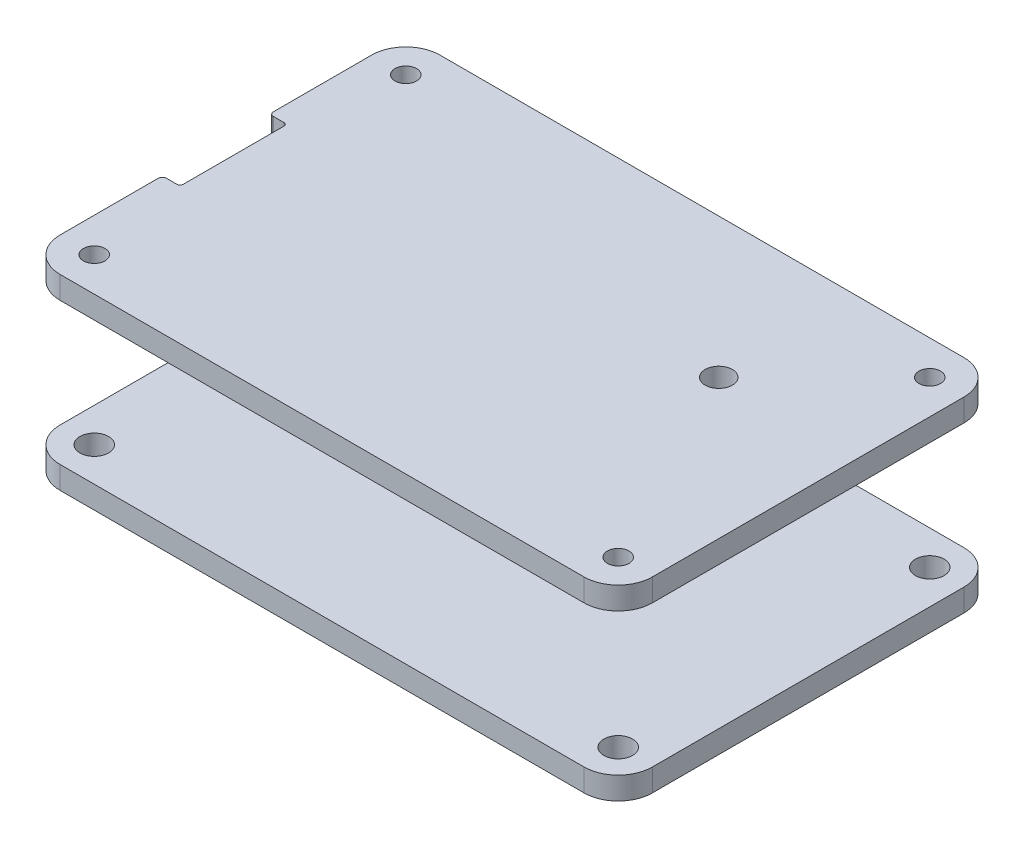
from build123d import *

# Parameters (mm, degrees)
BOSS_EXTRUDE1_DEPTH             = 20.07
SKETCH3_R                       = 1.6
BOSS_EXTRUDE2_DEPTH             = 5.5
FILLET1_R                       = 2.5
CUT_EXTRUDE1_REACH              = 102.265
SKETCH4_R                       = 3.25
CUT_EXTRUDE2_REACH              = 102.265
SKETCH5_R                       = 2.15
CUT_EXTRUDE5_REACH              = 101.74
MOVE_START                      = 79.994994432
MOVE_FACE1_OUTLINE_R            = 3.75
MOVE_FACE1_OUTLINE_R_2          = 3.25
MOVE_FACE1_DEPTH                = 3.005005568
MOVE_START_2                    = -3
MOVE_FACE1_2_OUTLINE_R          = 2.65
MOVE_FACE1_2_OUTLINE_R_2        = 2.15
MOVE_FACE1_2_DEPTH              = 82.994994432
MOVE_FACE2_BY                   = 0.1
MOVE_FACE2_2_BY                 = 0.1
MOVE_FACE2_3_BY                 = 0.1
MOVE_FACE2_4_BY                 = 0.1
MOVE_FACE2_5_BY                 = 0.1
MOVE_FACE2_6_BY                 = 0.1
MOVE_FACE2_7_BY                 = 0.1
MOVE_FACE2_8_BY                 = 0.1
MOVE_FACE2_9_BY                 = 0.1
MOVE_FACE2_10_BY                = 0.1
MOVE_FACE2_11_BY                = 0.1
MOVE_FACE3_BY                   = 0.1
MOVE_FACE3_2_BY                 = 0.1
MOVE_FACE3_3_BY                 = 0.1
MOVE_FACE3_4_BY                 = 0.1
SKETCH6_R                       = 1.6
BOSS_EXTRUDE3_DEPTH             = 3.175
SKETCH7_R                       = 2
CUT_EXTRUDE3_DEPTH              = 3.175
SKETCH8_W                       = 2.5
SKETCH8_H                       = 15.2622
CUT_EXTRUDE4_DEPTH              = 3.175
SKETCH10_R                      = 2.1
M3_HEAT_SET_INSERT_HOLES_DEPTH  = 3.175
FILLET2_R                       = 0.5
KERF_START                      = -3.175
KERF_COMPENSATION_OUTLINE_R     = 2.1
KERF_COMPENSATION_OUTLINE_R_2   = 2.0238
KERF_COMPENSATION_DEPTH         = 3.175
KERF_START_2                    = 20.07
KERF_COMPENSATION_2_OUTLINE_R   = 1.6
KERF_COMPENSATION_2_OUTLINE_R_2 = 1.5238
KERF_COMPENSATION_2_OUTLINE_R_3 = 2
KERF_COMPENSATION_2_OUTLINE_R_4 = 1.9238
KERF_COMPENSATION_2_DEPTH       = 3.175


with BuildPart() as part:
    # Sketch2 → Boss-Extrude1 (new body)
    with BuildSketch(Plane(origin=(0, 0, 0), x_dir=(1, 0, 0), z_dir=(0, 1, 0))):
        with BuildLine():
            Line((77, 51.75), (3, 51.75))
            ThreePointArc((3, 51.75), (-0.358757211, 50.358757211), (-1.75, 47))
            Line((-1.75, 47), (-1.75, 3))
            ThreePointArc((-1.75, 3), (-0.358757211, -0.358757211), (3, -1.75))
            Line((3, -1.75), (77, -1.75))
            ThreePointArc((77, -1.75), (80.358757211, -0.358757211), (81.75, 3))
            Line((81.75, 3), (81.75, 47))
            ThreePointArc((81.75, 47), (80.358757211, 50.358757211), (77, 51.75))
        make_face()
        with BuildLine():
            Line((-0.25, 47), (-0.25, 3))
            ThreePointArc((-0.25, 3), (0.701902961, 0.701902961), (3, -0.25))
            Line((3, -0.25), (77, -0.25))
            ThreePointArc((77, -0.25), (79.298097039, 0.701902961), (80.25, 3))
            Line((80.25, 3), (80.25, 47))
            ThreePointArc((80.25, 47), (79.298097039, 49.298097039), (77, 50.25))
            Line((77, 50.25), (3, 50.25))
            ThreePointArc((3, 50.25), (0.701902961, 49.298097039), (-0.25, 47))
        make_face(mode=Mode.SUBTRACT)
    extrude(amount=BOSS_EXTRUDE1_DEPTH)

    # Sketch3 → Boss-Extrude2 (add)
    # profile 1 of 4: a face of its own
    with BuildSketch(Plane.XZ):
        with BuildLine():
            ThreePointArc((-0.25, -47), (0.701902961, -49.298097039), (3, -50.25))
            Line((3, -50.25), (5.5, -50.25))
            Line((5.5, -50.25), (5.5, -44.5))
            Line((5.5, -44.5), (-0.25, -44.5))
            Line((-0.25, -44.5), (-0.25, -47))
        make_face()
        with Locations(Location((3, -47, 0), (0, 0, 270))):
            Circle(SKETCH3_R, mode=Mode.SUBTRACT)
    # profile 2 of 4: a face of its own
    with BuildSketch(Plane.XZ):
        with BuildLine():
            Line((74.5, -44.5), (74.5, -50.25))
            Line((74.5, -50.25), (77, -50.25))
            ThreePointArc((77, -50.25), (79.298097039, -49.298097039), (80.25, -47))
            Line((80.25, -47), (80.25, -44.5))
            Line((80.25, -44.5), (74.5, -44.5))
        make_face()
        with Locations(Location((77, -47, 0), (0, 0, 270))):
            Circle(SKETCH3_R, mode=Mode.SUBTRACT)
    # profile 3 of 4: a face of its own
    with BuildSketch(Plane.XZ):
        with BuildLine():
            Line((74.5, -5.5), (80.25, -5.5))
            Line((80.25, -5.5), (80.25, -3))
            ThreePointArc((80.25, -3), (79.298097039, -0.701902961), (77, 0.25))
            Line((77, 0.25), (74.5, 0.25))
            Line((74.5, 0.25), (74.5, -5.5))
        make_face()
        with Locations(Location((77, -3, 0), (0, 0, 270))):
            Circle(SKETCH3_R, mode=Mode.SUBTRACT)
    # profile 4 of 4: a face of its own
    with BuildSketch(Plane.XZ):
        with BuildLine():
            Line((-0.25, -3), (-0.25, -5.5))
            Line((-0.25, -5.5), (5.5, -5.5))
            Line((5.5, -5.5), (5.5, 0.25))
            Line((5.5, 0.25), (3, 0.25))
            ThreePointArc((3, 0.25), (0.701902961, -0.701902961), (-0.25, -3))
        make_face()
        with Locations(Location((3, -3, 0), (0, 0, 270))):
            Circle(SKETCH3_R, mode=Mode.SUBTRACT)
    extrude(amount=-BOSS_EXTRUDE2_DEPTH)

    # Fillet1
    fillet1_edges = [part.edges().sort_by_distance(p)[0] for p in [
        (5.5, 2.75, 0.25),
        (5.5, 2.75, -5.5),
        (-0.25, 2.75, -5.5),
        (5.5, 2.75, -44.5),
        (5.5, 2.75, -50.25),
        (-0.25, 2.75, -44.5),
        (74.5, 2.75, -50.25),
        (74.5, 2.75, -44.5),
        (80.25, 2.75, -44.5),
        (74.5, 2.75, -5.5),
        (74.5, 2.75, 0.25),
        (80.25, 2.75, -5.5),
    ]]
    fillet(fillet1_edges, radius=FILLET1_R)

    # Sketch4 → Cut-Extrude1 (cut, up to next)
    with BuildSketch(Plane(origin=(81.75, 0, 0), x_dir=(0, 0, -1), z_dir=(1, 0, 0)), mode=Mode.PRIVATE) as cut_extrude1_sk1:
        with Locations((11.25, 13.5662)):
            Circle(SKETCH4_R)
    cut_extrude1_tool1 = extrude(cut_extrude1_sk1.sketch, amount=-CUT_EXTRUDE1_REACH, mode=Mode.PRIVATE) & part.part
    # Sketch4 → Cut-Extrude1 (cut, up to next)
    with BuildSketch(Plane(origin=(81.75, 0, 0), x_dir=(0, 0, -1), z_dir=(1, 0, 0)), mode=Mode.PRIVATE) as cut_extrude1_sk2:
        with BuildLine():
            Line((21.83, 7.07), (28.17, 7.07))
            ThreePointArc((28.17, 7.07), (29.089238816, 7.450761184), (29.47, 8.37))
            Line((29.47, 8.37), (29.47, 9.13))
            ThreePointArc((29.47, 9.13), (29.089238816, 10.049238816), (28.17, 10.43))
            Line((28.17, 10.43), (21.83, 10.43))
            ThreePointArc((21.83, 10.43), (20.910761184, 10.049238816), (20.53, 9.13))
            Line((20.53, 9.13), (20.53, 8.37))
            ThreePointArc((20.53, 8.37), (20.910761184, 7.450761184), (21.83, 7.07))
        make_face()
    cut_extrude1_tool2 = extrude(cut_extrude1_sk2.sketch, amount=-CUT_EXTRUDE1_REACH, mode=Mode.PRIVATE) & part.part
    # Sketch4 → Cut-Extrude1 (cut, up to next)
    with BuildSketch(Plane(origin=(81.75, 0, 0), x_dir=(0, 0, -1), z_dir=(1, 0, 0)), mode=Mode.PRIVATE) as cut_extrude1_sk3:
        with BuildLine():
            Line((36.5, 14.4662), (36.5, 20.07))
            ThreePointArc((36.5, 20.07), (39.6, 23.17), (42.7, 20.07))
            Line((42.7, 20.07), (42.7, 14.4662))
            ThreePointArc((42.7, 14.4662), (39.6, 11.3662), (36.5, 14.4662))
        make_face()
    cut_extrude1_tool3 = extrude(cut_extrude1_sk3.sketch, amount=-CUT_EXTRUDE1_REACH, mode=Mode.PRIVATE) & part.part
    # Sketch4 → Cut-Extrude1 (cut, up to next)
    with BuildSketch(Plane(origin=(81.75, 0, 0), x_dir=(0, 0, -1), z_dir=(1, 0, 0)), mode=Mode.PRIVATE) as cut_extrude1_sk4:
        Polygon((36.6, 2.78), (36.6, 5.28), (42.6, 5.28), (42.6, 2.704447838), (42.6, 0), (36.6, 0), align=None)
    cut_extrude1_tool4 = extrude(cut_extrude1_sk4.sketch, amount=-CUT_EXTRUDE1_REACH, mode=Mode.PRIVATE) & part.part
    add(cut_extrude1_tool1.solids().sort_by_distance((81.75, 13.5662, -11.25))[0], mode=Mode.SUBTRACT)
    add(cut_extrude1_tool2.solids().sort_by_distance((81.75, 8.75, -25))[0], mode=Mode.SUBTRACT)
    add(cut_extrude1_tool3.solids().sort_by_distance((81.75, 17.2681, -39.6))[0], mode=Mode.SUBTRACT)
    add(cut_extrude1_tool4.solids().sort_by_distance((81.75, 2.64, -39.6))[0], mode=Mode.SUBTRACT)

    # Sketch5 → Cut-Extrude2 (cut, up to next)
    with BuildSketch(Plane.ZY.offset(1.75), mode=Mode.PRIVATE) as cut_extrude2_sk1:
        with Locations((-11.97865482, 11.37450981)):
            Circle(SKETCH5_R)
    cut_extrude2_tool1 = extrude(cut_extrude2_sk1.sketch, amount=-CUT_EXTRUDE2_REACH, mode=Mode.PRIVATE) & part.part
    # Sketch5 → Cut-Extrude2 (cut, up to next)
    with BuildSketch(Plane.ZY.offset(1.75), mode=Mode.PRIVATE) as cut_extrude2_sk2:
        with BuildLine():
            Line((-32.5311, 15.7022), (-32.5311, 20.07))
            ThreePointArc((-32.5311, 20.07), (-25, 27.6011), (-17.4689, 20.07))
            Line((-17.4689, 20.07), (-17.4689, 15.7022))
            ThreePointArc((-17.4689, 15.7022), (-25, 8.1711), (-32.5311, 15.7022))
        make_face()
    cut_extrude2_tool2 = extrude(cut_extrude2_sk2.sketch, amount=-CUT_EXTRUDE2_REACH, mode=Mode.PRIVATE) & part.part
    add(cut_extrude2_tool1.solids().sort_by_distance((-1.75, 11.37451, -11.978655))[0], mode=Mode.SUBTRACT)
    add(cut_extrude2_tool2.solids().sort_by_distance((-1.75, 17.8861, -25))[0], mode=Mode.SUBTRACT)

    # Sketch9 → Cut-Extrude5 (cut, up to next)
    with BuildSketch(Plane.XY.offset(1.75), mode=Mode.PRIVATE) as cut_extrude5_sk1:
        with BuildLine():
            Line((33.55, 7.07), (33.55, 11.07))
            ThreePointArc((33.55, 11.07), (34.3, 11.82), (35.05, 11.07))
            Line((35.05, 11.07), (35.05, 7.07))
            ThreePointArc((35.05, 7.07), (34.3, 6.32), (33.55, 7.07))
        make_face()
    cut_extrude5_tool1 = extrude(cut_extrude5_sk1.sketch, amount=-CUT_EXTRUDE5_REACH, mode=Mode.PRIVATE) & part.part
    add(cut_extrude5_tool1.solids().sort_by_distance((34.3, 9.07, 1.75))[0], mode=Mode.SUBTRACT)

    # Move Face1: read off the stored shape, not the designer's step
    # Move Face1 outline → Move Face1 (cut)
    # profile 1 of 3: a face of its own
    with BuildSketch(Plane.YZ.offset(MOVE_START)):
        Polygon((0, -42.6), (0, -43.1), (5.5, -43.1), (5.78, -43.1), (5.78, -36.1), (0, -36.1), (0, -36.6), (5.28, -36.6), (5.28, -42.6), align=None)
    # profile 2 of 3: a face of its own
    with BuildSketch(Plane.YZ.offset(MOVE_START)):
        with Locations((13.5662, -11.25)):
            Circle(MOVE_FACE1_OUTLINE_R)
        with Locations((13.5662, -11.25)):
            Circle(MOVE_FACE1_OUTLINE_R_2, mode=Mode.SUBTRACT)
    # profile 3 of 3: a face of its own
    with BuildSketch(Plane.YZ.offset(MOVE_START)):
        with BuildLine():
            ThreePointArc((14.4662, -36), (10.8662, -39.6), (14.4662, -43.2))
            Line((14.4662, -43.2), (20.07, -43.2))
            Line((20.07, -43.2), (20.07, -42.7))
            Line((20.07, -42.7), (14.4662, -42.7))
            ThreePointArc((14.4662, -42.7), (11.3662, -39.6), (14.4662, -36.5))
            Line((14.4662, -36.5), (20.07, -36.5))
            Line((20.07, -36.5), (20.07, -36))
            Line((20.07, -36), (14.4662, -36))
        make_face()
    extrude(amount=MOVE_FACE1_DEPTH, mode=Mode.SUBTRACT)

    # Move Face1 2 outline → Move Face1 2 (cut)
    with BuildSketch(Plane.YZ.offset(MOVE_START_2)):
        with Locations((11.37450981, -11.97865482)):
            Circle(MOVE_FACE1_2_OUTLINE_R)
        with Locations((11.37450981, -11.97865482)):
            Circle(MOVE_FACE1_2_OUTLINE_R_2, mode=Mode.SUBTRACT)
    extrude(amount=MOVE_FACE1_2_DEPTH, mode=Mode.SUBTRACT)

    # Move Face2: a curved face moved inward by 0.1
    add(Solid.thicken(part.faces().sort_by_distance((81, 7.450761184, -29.089238816))[0], -MOVE_FACE2_BY), mode=Mode.SUBTRACT)

    # Move Face2 2: a face moved inward by 0.1
    extrude(part.faces().sort_by_distance((81, 10.43, -25))[0], amount=MOVE_FACE2_2_BY, dir=(0, 1, 0), mode=Mode.SUBTRACT)

    # Move Face2 3: a face moved inward by 0.1
    extrude(part.faces().sort_by_distance((81, 8.75, -29.47))[0], amount=MOVE_FACE2_3_BY, dir=(0, 0, -1), mode=Mode.SUBTRACT)

    # Move Face2 4: a curved face moved inward by 0.1
    add(Solid.thicken(part.faces().sort_by_distance((81, 10.049238816, -29.089238816))[0], -MOVE_FACE2_4_BY), mode=Mode.SUBTRACT)

    # Move Face2 5: a curved face moved inward by 0.1
    add(Solid.thicken(part.faces().sort_by_distance((81, 10.049238816, -20.910761184))[0], -MOVE_FACE2_5_BY), mode=Mode.SUBTRACT)

    # Move Face2 6: a face moved inward by 0.1
    extrude(part.faces().sort_by_distance((81, 8.75, -20.53))[0], amount=MOVE_FACE2_6_BY, dir=(0, 0, 1), mode=Mode.SUBTRACT)

    # Move Face2 7: a face moved inward by 0.1
    extrude(part.faces().sort_by_distance((81, 7.07, -25))[0], amount=MOVE_FACE2_7_BY, dir=(0, -1, 0), mode=Mode.SUBTRACT)

    # Move Face2 8: a curved face moved inward by 0.1
    add(Solid.thicken(part.faces().sort_by_distance((81, 7.450761184, -20.910761184))[0], -MOVE_FACE2_8_BY), mode=Mode.SUBTRACT)

    # Move Face2 9: a curved face moved inward by 0.1
    add(Solid.thicken(part.faces().sort_by_distance((-1, 8.1711, -25))[0], -MOVE_FACE2_9_BY), mode=Mode.SUBTRACT)

    # Move Face2 10: a face moved inward by 0.1
    extrude(part.faces().sort_by_distance((-1, 17.8861, -32.5311))[0], amount=MOVE_FACE2_10_BY, dir=(0, 0, -1), mode=Mode.SUBTRACT)

    # Move Face2 11: a face moved inward by 0.1
    extrude(part.faces().sort_by_distance((-1, 17.8861, -17.4689))[0], amount=MOVE_FACE2_11_BY, dir=(0, 0, 1), mode=Mode.SUBTRACT)

    # Move Face3: a curved face moved inward by 0.1
    add(Solid.thicken(part.faces().sort_by_distance((3, 2.75, -45.4))[0], -MOVE_FACE3_BY), mode=Mode.SUBTRACT)

    # Move Face3 2: a curved face moved inward by 0.1
    add(Solid.thicken(part.faces().sort_by_distance((77, 2.75, -45.4))[0], -MOVE_FACE3_2_BY), mode=Mode.SUBTRACT)

    # Move Face3 3: a curved face moved inward by 0.1
    add(Solid.thicken(part.faces().sort_by_distance((77, 2.75, -1.4))[0], -MOVE_FACE3_3_BY), mode=Mode.SUBTRACT)

    # Move Face3 4: a curved face moved inward by 0.1
    add(Solid.thicken(part.faces().sort_by_distance((3, 2.75, -1.4))[0], -MOVE_FACE3_4_BY), mode=Mode.SUBTRACT)


with BuildPart() as body_2:
    # Sketch6 → Boss-Extrude3 (new body)
    with BuildSketch(Plane(origin=(0, 20.07, 0), x_dir=(1, 0, 0), z_dir=(0, 1, 0))):
        with BuildLine():
            Line((3, -1.75), (77, -1.75))
            ThreePointArc((77, -1.75), (80.358757211, -0.358757211), (81.75, 3))
            Line((81.75, 3), (81.75, 47))
            ThreePointArc((81.75, 47), (80.358757211, 50.358757211), (77, 51.75))
            Line((77, 51.75), (3, 51.75))
            ThreePointArc((3, 51.75), (-0.358757211, 50.358757211), (-1.75, 47))
            Line((-1.75, 47), (-1.75, 3))
            ThreePointArc((-1.75, 3), (-0.358757211, -0.358757211), (3, -1.75))
        make_face()
        with Locations(Location((77, 47, 0), (0, 0, 270))):
            Circle(SKETCH6_R, mode=Mode.SUBTRACT)
        with Locations(Location((3, 47, 0), (0, 0, 270))):
            Circle(SKETCH6_R, mode=Mode.SUBTRACT)
        with Locations(Location((77, 3, 0), (0, 0, 270))):
            Circle(SKETCH6_R, mode=Mode.SUBTRACT)
        with Locations(Location((3, 3, 0), (0, 0, 270))):
            Circle(SKETCH6_R, mode=Mode.SUBTRACT)
    extrude(amount=BOSS_EXTRUDE3_DEPTH)


with BuildPart() as body_3:
    # Body-Move/Copy3: copy of body 2
    add(body_2.part.moved(Location((0, -44.867382743, 0))))


with BuildPart() as body_3_1:
    # Body-Move/Copy4: read off the stored shape, not the designer's step
    # Body-Move/Copy4: moved
    add(body_3.part.moved(Location((0, 21.6223827, 0))))

    # Sketch10 → M3 Heat Set Insert Holes (cut)
    with BuildSketch(Plane.XZ.offset(3.175)):
        with Locations(Location((77, -3, 0), (0, 0, 270))):
            Circle(SKETCH10_R)
        with Locations(Location((3, -3, 0), (0, 0, 270))):
            Circle(SKETCH10_R)
        with Locations(Location((77, -47, 0), (0, 0, 270))):
            Circle(SKETCH10_R)
        with Locations(Location((3, -47, 0), (0, 0, 270))):
            Circle(SKETCH10_R)
    extrude(amount=-M3_HEAT_SET_INSERT_HOLES_DEPTH, mode=Mode.SUBTRACT)

    # kerf compensation: read off the stored shape, not the designer's step
    # kerf compensation outline → kerf compensation (add)
    # profile 1 of 5: a face of its own
    with BuildSketch(Plane(origin=(0, 0, 0), x_dir=(1, 0, 0), z_dir=(0, 1, 0)).offset(KERF_START)):
        with BuildLine():
            ThreePointArc((77, -1.8262), (80.412638747, -0.412638747), (81.8262, 3))
            Line((81.8262, 3), (81.8262, 47))
            ThreePointArc((81.8262, 47), (80.412638747, 50.412638747), (77, 51.8262))
            Line((77, 51.8262), (3, 51.8262))
            ThreePointArc((3, 51.8262), (-0.412638747, 50.412638747), (-1.8262, 47))
            Line((-1.8262, 47), (-1.8262, 3))
            ThreePointArc((-1.8262, 3), (-0.412638747, -0.412638747), (3, -1.8262))
            Line((3, -1.8262), (77, -1.8262))
        make_face()
        with BuildLine():
            Line((81.75, 47), (81.75, 3))
            ThreePointArc((81.75, 3), (80.358757211, -0.358757211), (77, -1.75))
            Line((77, -1.75), (3, -1.75))
            ThreePointArc((3, -1.75), (-0.358757211, -0.358757211), (-1.75, 3))
            Line((-1.75, 3), (-1.75, 47))
            ThreePointArc((-1.75, 47), (-0.358757211, 50.358757211), (3, 51.75))
            Line((3, 51.75), (77, 51.75))
            ThreePointArc((77, 51.75), (80.358757211, 50.358757211), (81.75, 47))
        make_face(mode=Mode.SUBTRACT)
    # profile 2 of 5: a face of its own
    with BuildSketch(Plane(origin=(0, 0, 0), x_dir=(1, 0, 0), z_dir=(0, 1, 0)).offset(KERF_START)):
        with Locations((77, 3)):
            Circle(KERF_COMPENSATION_OUTLINE_R)
        with Locations((77, 3)):
            Circle(KERF_COMPENSATION_OUTLINE_R_2, mode=Mode.SUBTRACT)
    # profile 3 of 5: a face of its own
    with BuildSketch(Plane(origin=(0, 0, 0), x_dir=(1, 0, 0), z_dir=(0, 1, 0)).offset(KERF_START)):
        with Locations((3, 47)):
            Circle(KERF_COMPENSATION_OUTLINE_R)
        with Locations((3, 47)):
            Circle(KERF_COMPENSATION_OUTLINE_R_2, mode=Mode.SUBTRACT)
    # profile 4 of 5: a face of its own
    with BuildSketch(Plane(origin=(0, 0, 0), x_dir=(1, 0, 0), z_dir=(0, 1, 0)).offset(KERF_START)):
        with Locations((77, 47)):
            Circle(KERF_COMPENSATION_OUTLINE_R)
        with Locations((77, 47)):
            Circle(KERF_COMPENSATION_OUTLINE_R_2, mode=Mode.SUBTRACT)
    # profile 5 of 5: a face of its own
    with BuildSketch(Plane(origin=(0, 0, 0), x_dir=(1, 0, 0), z_dir=(0, 1, 0)).offset(KERF_START)):
        with Locations((3, 3)):
            Circle(KERF_COMPENSATION_OUTLINE_R)
        with Locations((3, 3)):
            Circle(KERF_COMPENSATION_OUTLINE_R_2, mode=Mode.SUBTRACT)
    extrude(amount=KERF_COMPENSATION_DEPTH)


with BuildPart() as body_2_1:
    add(body_2.part)

    # Sketch7 → Cut-Extrude3 (cut)
    with BuildSketch(Plane(origin=(0, 23.245, 0), x_dir=(1, 0, 0), z_dir=(0, 1, 0))):
        with Locations(Location((62.1, 32.1, 0), (0, 0, 270))):
            Circle(SKETCH7_R)
    extrude(amount=-CUT_EXTRUDE3_DEPTH, mode=Mode.SUBTRACT)

    # Sketch8 → Cut-Extrude4 (cut)
    with BuildSketch(Plane(origin=(0, 23.245, 0), x_dir=(1, 0, 0), z_dir=(0, 1, 0))):
        with Locations((-0.5, 25)):
            Rectangle(SKETCH8_W, SKETCH8_H)
    extrude(amount=-CUT_EXTRUDE4_DEPTH, mode=Mode.SUBTRACT)

    # Fillet2
    fillet2_edges = [body_2_1.edges().sort_by_distance(p)[0] for p in [
        (-1.75, 21.6575, -17.3689),
        (-1.75, 21.6575, -32.6311),
        (0.75, 21.6575, -32.6311),
        (0.75, 21.6575, -17.3689),
    ]]
    fillet(fillet2_edges, radius=FILLET2_R)

    # kerf compensation 2 outline → kerf compensation 2 (add)
    # profile 1 of 6: a face of its own
    with BuildSketch(Plane(origin=(0, 0, 0), x_dir=(1, 0, 0), z_dir=(0, 1, 0)).offset(KERF_START_2)):
        with BuildLine():
            Line((-1.8262, 47), (-1.8262, 33.1311))
            ThreePointArc((-1.8262, 33.1311), (-1.657434927, 32.723665073), (-1.25, 32.5549))
            Line((-1.25, 32.5549), (0.25, 32.5549))
            ThreePointArc((0.25, 32.5549), (0.549671854, 32.430771854), (0.6738, 32.1311))
            Line((0.6738, 32.1311), (0.6738, 17.8689))
            ThreePointArc((0.6738, 17.8689), (0.549671854, 17.569228146), (0.25, 17.4451))
            Line((0.25, 17.4451), (-1.25, 17.4451))
            ThreePointArc((-1.25, 17.4451), (-1.657434927, 17.276334927), (-1.8262, 16.8689))
            Line((-1.8262, 16.8689), (-1.8262, 3))
            ThreePointArc((-1.8262, 3), (-0.412638747, -0.412638747), (3, -1.8262))
            Line((3, -1.8262), (77, -1.8262))
            ThreePointArc((77, -1.8262), (80.412638747, -0.412638747), (81.8262, 3))
            Line((81.8262, 3), (81.8262, 47))
            ThreePointArc((81.8262, 47), (80.412638747, 50.412638747), (77, 51.8262))
            Line((77, 51.8262), (3, 51.8262))
            ThreePointArc((3, 51.8262), (-0.412638747, 50.412638747), (-1.8262, 47))
        make_face()
        with BuildLine():
            ThreePointArc((-1.25, 32.6311), (-1.603553391, 32.777546609), (-1.75, 33.1311))
            Line((-1.75, 33.1311), (-1.75, 47))
            ThreePointArc((-1.75, 47), (-0.358757211, 50.358757211), (3, 51.75))
            Line((3, 51.75), (77, 51.75))
            ThreePointArc((77, 51.75), (80.358757211, 50.358757211), (81.75, 47))
            Line((81.75, 47), (81.75, 3))
            ThreePointArc((81.75, 3), (80.358757211, -0.358757211), (77, -1.75))
            Line((77, -1.75), (3, -1.75))
            ThreePointArc((3, -1.75), (-0.358757211, -0.358757211), (-1.75, 3))
            Line((-1.75, 3), (-1.75, 16.8689))
            ThreePointArc((-1.75, 16.8689), (-1.603553391, 17.222453391), (-1.25, 17.3689))
            Line((-1.25, 17.3689), (0.25, 17.3689))
            ThreePointArc((0.25, 17.3689), (0.603553391, 17.515346609), (0.75, 17.8689))
            Line((0.75, 17.8689), (0.75, 32.1311))
            ThreePointArc((0.75, 32.1311), (0.603553391, 32.484653391), (0.25, 32.6311))
            Line((0.25, 32.6311), (-1.25, 32.6311))
        make_face(mode=Mode.SUBTRACT)
    # profile 2 of 6: a face of its own
    with BuildSketch(Plane(origin=(0, 0, 0), x_dir=(1, 0, 0), z_dir=(0, 1, 0)).offset(KERF_START_2)):
        with Locations((77, 47)):
            Circle(KERF_COMPENSATION_2_OUTLINE_R)
        with Locations((77, 47)):
            Circle(KERF_COMPENSATION_2_OUTLINE_R_2, mode=Mode.SUBTRACT)
    # profile 3 of 6: a face of its own
    with BuildSketch(Plane(origin=(0, 0, 0), x_dir=(1, 0, 0), z_dir=(0, 1, 0)).offset(KERF_START_2)):
        with Locations((3, 47)):
            Circle(KERF_COMPENSATION_2_OUTLINE_R)
        with Locations((3, 47)):
            Circle(KERF_COMPENSATION_2_OUTLINE_R_2, mode=Mode.SUBTRACT)
    # profile 4 of 6: a face of its own
    with BuildSketch(Plane(origin=(0, 0, 0), x_dir=(1, 0, 0), z_dir=(0, 1, 0)).offset(KERF_START_2)):
        with Locations((77, 3)):
            Circle(KERF_COMPENSATION_2_OUTLINE_R)
        with Locations((77, 3)):
            Circle(KERF_COMPENSATION_2_OUTLINE_R_2, mode=Mode.SUBTRACT)
    # profile 5 of 6: a face of its own
    with BuildSketch(Plane(origin=(0, 0, 0), x_dir=(1, 0, 0), z_dir=(0, 1, 0)).offset(KERF_START_2)):
        with Locations((3, 3)):
            Circle(KERF_COMPENSATION_2_OUTLINE_R)
        with Locations((3, 3)):
            Circle(KERF_COMPENSATION_2_OUTLINE_R_2, mode=Mode.SUBTRACT)
    # profile 6 of 6: a face of its own
    with BuildSketch(Plane(origin=(0, 0, 0), x_dir=(1, 0, 0), z_dir=(0, 1, 0)).offset(KERF_START_2)):
        with Locations((62.1, 32.1)):
            Circle(KERF_COMPENSATION_2_OUTLINE_R_3)
        with Locations((62.1, 32.1)):
            Circle(KERF_COMPENSATION_2_OUTLINE_R_4, mode=Mode.SUBTRACT)
    extrude(amount=KERF_COMPENSATION_2_DEPTH)


solid = Compound([body_3_1.part, body_2_1.part])
